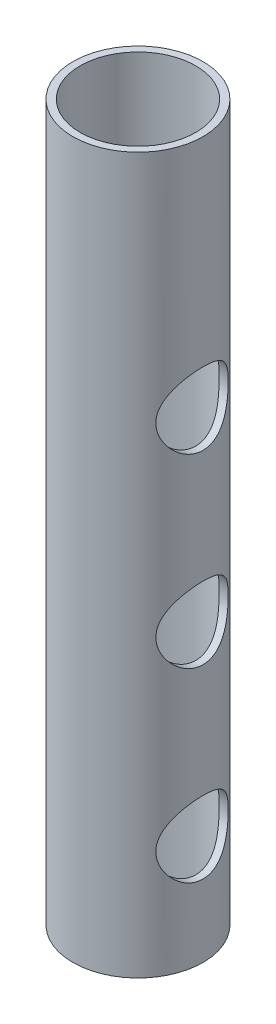
from build123d import *

# Parameters (mm, degrees)
SKETCH1_R           = 17.875
SKETCH1_R_2         = 15.875
BOSS_EXTRUDE1_DEPTH = 196.5
SKETCH2_R           = 9.94
CUT_EXTRUDE1_DEPTH  = 199.119361118


with BuildPart() as part:
    # Sketch1 → Boss-Extrude1 (new body)
    with BuildSketch(Plane(origin=(0, 0, 0), x_dir=(1, 0, 0), z_dir=(0, 1, 0))):
        Circle(SKETCH1_R)
        Circle(SKETCH1_R_2, mode=Mode.SUBTRACT)
    extrude(amount=BOSS_EXTRUDE1_DEPTH)

    # Sketch2 → Cut-Extrude1 (cut, through all)
    with BuildSketch(Plane(origin=(0, 0, 0), x_dir=(0, 0, -1), z_dir=(1, 0, 0))):
        with Locations((0, 131.8)):
            Circle(SKETCH2_R)
        with Locations((0, 80.8)):
            Circle(SKETCH2_R)
        with Locations((0, 29.8)):
            Circle(SKETCH2_R)
    extrude(amount=CUT_EXTRUDE1_DEPTH, mode=Mode.SUBTRACT)


solid = part.part
